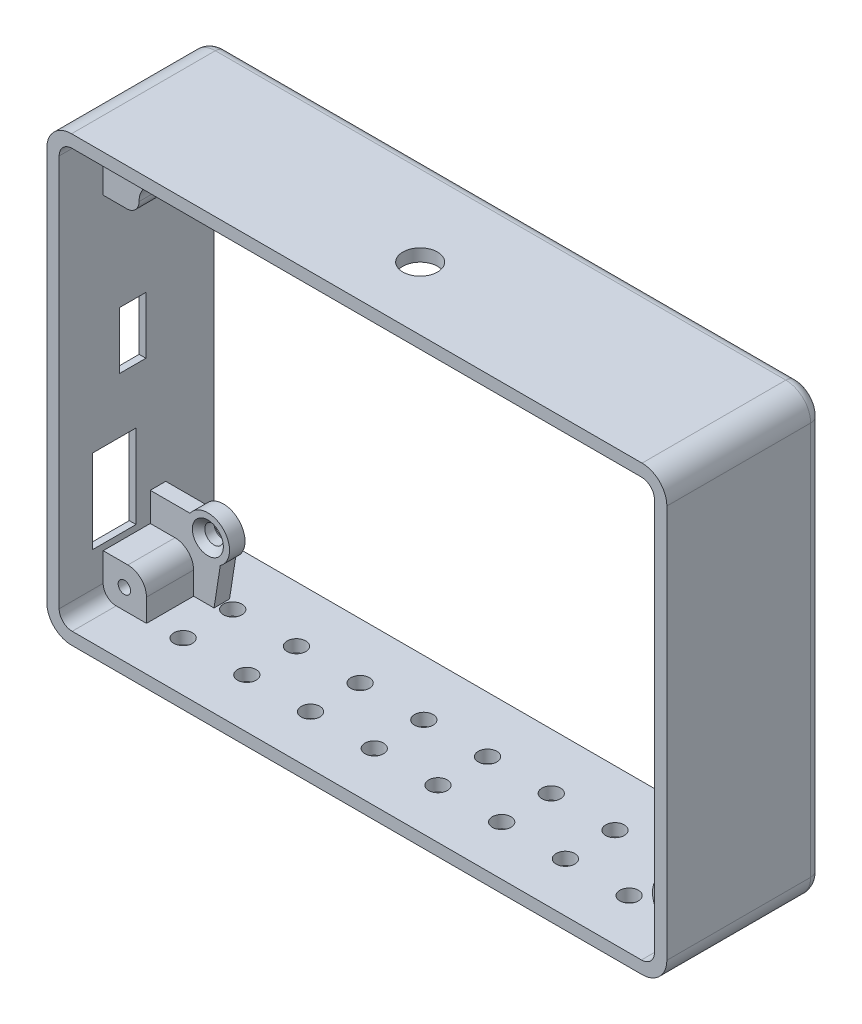
from build123d import *

# Parameters (mm, degrees)
CUT_EXTRUDE_START         = -25
CUT_EXTRUDE_1_OUTLINE_R   = 1
CUT_EXTRUDE_1_OUTLINE_R_2 = 1.5
CUT_EXTRUDE_1_DEPTH       = 17.2
CUT_EXTRUDE_START_2       = -7.8
CUT_EXTRUDE_1_2_DEPTH     = 7.8
CUT_EXTRUDE_2_DEPTH       = 7.1
SKETCH_5_R                = 1.5
SKETCH_5_R_2              = 3.5
CUT_EXTRUDE_3_DEPTH       = 7.6
FILLET_1_R                = 2
FILLET_2_R                = 1.8
SKETCH_12_W               = 9
SKETCH_12_H               = 15.496277761
SKETCH_12_W_2             = 8.286045674
SKETCH_12_H_2             = 13.20751885
CUT_EXTRUDE_7_DEPTH       = 0.90676236
SKETCH_13_W               = 7
SKETCH_13_H               = 13.496277761
SKETCH_13_W_2             = 4.286045674
SKETCH_13_H_2             = 9.20751885
CUT_EXTRUDE_8_DEPTH       = 10
SKETCH_14_W               = 10
SKETCH_14_H               = 5
CUT_EXTRUDE_9_DEPTH       = 7.6
FILLET_3_R                = 0.8
SKETCH_16_R               = 2.8
CUT_EXTRUDE_10_DEPTH      = 2
SKETCH_17_R               = 1.5
CUT_EXTRUDE_11_DEPTH      = 2
SKETCH_18_W               = 4.300074763
SKETCH_18_H               = 6.665650657
CUT_EXTRUDE_12_DEPTH      = 7.6
FILLET_4_R                = 3
CUT_EXTRUDE_13_DEPTH      = 2.6
SKETCH_20_W               = 3
SKETCH_20_H               = 23.2
EXTRUDE_2_DEPTH           = 2
CHAMFER_2_SIZE            = 2
CHAMFER_3_SIZE            = 1


with BuildPart() as part:
    # Вырез-Вытянуть1: read off the stored shape, not the designer's step
    # Вырез-Вытянуть1 outline → Вырез-Вытянуть1 (new body)
    with BuildSketch(Plane(origin=(0, 0, 0), x_dir=(-1, 0, 0), z_dir=(0, 0, -1)).offset(CUT_EXTRUDE_START)):
        with BuildLine():
            Line((46.025, 35.7375), (-46.025, 35.7375))
            ThreePointArc((-46.025, 35.7375), (-48.853427125, 34.565927125), (-50.025, 31.7375))
            Line((-50.025, 31.7375), (-50.025, -31.7375))
            ThreePointArc((-50.025, -31.7375), (-48.853427125, -34.565927125), (-46.025, -35.7375))
            Line((-46.025, -35.7375), (46.025, -35.7375))
            ThreePointArc((46.025, -35.7375), (48.853427125, -34.565927125), (50.025, -31.7375))
            Line((50.025, -31.7375), (50.025, 31.7375))
            ThreePointArc((50.025, 31.7375), (48.853427125, 34.565927125), (46.025, 35.7375))
        make_face()
        with BuildLine():
            ThreePointArc((-42.287410651, -33.7375), (-40.609110189, -30.427578056), (-42.373582962, -27.162779204))
            ThreePointArc((-42.373582962, -27.162779204), (-42.176095909, -21.875777657), (-47.437281323, -22.433733333))
            Line((-47.437281323, -22.433733333), (-48.025, -22.433733333))
            Line((-48.025, -22.433733333), (-48.025, 22.606266667))
            Line((-48.025, 22.606266667), (-47.437281323, 22.606266667))
            ThreePointArc((-47.437281323, 22.606266667), (-42.180470358, 22.044232634), (-42.364269143, 27.32780735))
            ThreePointArc((-42.364269143, 27.32780735), (-40.612710996, 30.461140888), (-42.07941, 33.7375))
            Line((-42.07941, 33.7375), (36.735, 33.7375))
            Line((36.735, 33.7375), (36.735, 27.47854799))
            ThreePointArc((36.735, 27.47854799), (36.260126266, 22.131392933), (41.607281323, 22.606266667))
            Line((41.607281323, 22.606266667), (48.025, 22.606266667))
            Line((48.025, 22.606266667), (48.025, -22.433733333))
            Line((48.025, -22.433733333), (41.607281323, -22.433733333))
            ThreePointArc((41.607281323, -22.433733333), (36.260126265, -21.9588596), (36.735, -27.306014657))
            Line((36.735, -27.306014657), (36.735, -33.7375))
            Line((36.735, -33.7375), (-42.287410651, -33.7375))
        make_face(mode=Mode.SUBTRACT)
        with BuildLine():
            Line((-48.025, -23.906097095), (-48.025, -24.961369572))
            ThreePointArc((-48.025, -24.961369572), (-48.065, -24.433733334), (-48.025, -23.906097095))
        make_face(mode=Mode.SUBTRACT)
        with Locations((-44.608766667, -30.48)):
            Circle(CUT_EXTRUDE_1_OUTLINE_R, mode=Mode.SUBTRACT)
        with Locations((-44.565, -24.433733333)):
            Circle(CUT_EXTRUDE_1_OUTLINE_R_2, mode=Mode.SUBTRACT)
        with Locations((38.735, -24.433733333)):
            Circle(CUT_EXTRUDE_1_OUTLINE_R_2, mode=Mode.SUBTRACT)
        with Locations((44.608733333, -30.48)):
            Circle(CUT_EXTRUDE_1_OUTLINE_R, mode=Mode.SUBTRACT)
        with Locations((44.608733333, 30.48)):
            Circle(CUT_EXTRUDE_1_OUTLINE_R, mode=Mode.SUBTRACT)
        with Locations((38.735, 24.606266667)):
            Circle(CUT_EXTRUDE_1_OUTLINE_R_2, mode=Mode.SUBTRACT)
        with Locations((-44.565, 24.606266667)):
            Circle(CUT_EXTRUDE_1_OUTLINE_R_2, mode=Mode.SUBTRACT)
        with Locations((-44.608766667, 30.638733333)):
            Circle(CUT_EXTRUDE_1_OUTLINE_R, mode=Mode.SUBTRACT)
    extrude(amount=CUT_EXTRUDE_1_DEPTH)

    # Cut-Extrude 1 2 outline → Cut-Extrude 1 2 (add)
    with BuildSketch(Plane(origin=(0, 0, 0), x_dir=(-1, 0, 0), z_dir=(0, 0, -1)).offset(CUT_EXTRUDE_START_2)):
        with BuildLine():
            Line((46.025, 35.7375), (-46.025, 35.7375))
            ThreePointArc((-46.025, 35.7375), (-48.853427125, 34.565927125), (-50.025, 31.7375))
            Line((-50.025, 31.7375), (-50.025, -31.7375))
            ThreePointArc((-50.025, -31.7375), (-48.853427125, -34.565927125), (-46.025, -35.7375))
            Line((-46.025, -35.7375), (46.025, -35.7375))
            ThreePointArc((46.025, -35.7375), (48.853427125, -34.565927125), (50.025, -31.7375))
            Line((50.025, -31.7375), (50.025, 31.7375))
            ThreePointArc((50.025, 31.7375), (48.853427125, 34.565927125), (46.025, 35.7375))
        make_face()
        with BuildLine():
            Line((45.925, -33.7375), (-45.925, -33.7375))
            ThreePointArc((-45.925, -33.7375), (-47.40992424, -33.12242424), (-48.025, -31.6375))
            Line((-48.025, -31.6375), (-48.025, -24.961369572))
            ThreePointArc((-48.025, -24.961369572), (-48.065, -24.433733334), (-48.025, -23.906097095))
            Line((-48.025, -23.906097095), (-48.025, 31.6375))
            ThreePointArc((-48.025, 31.6375), (-47.40992424, 33.12242424), (-45.925, 33.7375))
            Line((-45.925, 33.7375), (45.925, 33.7375))
            ThreePointArc((45.925, 33.7375), (47.40992424, 33.12242424), (48.025, 31.6375))
            Line((48.025, 31.6375), (48.025, -31.6375))
            ThreePointArc((48.025, -31.6375), (47.40992424, -33.12242424), (45.925, -33.7375))
        make_face(mode=Mode.SUBTRACT)
    extrude(amount=CUT_EXTRUDE_1_2_DEPTH)

    # Эскиз4 → Вырез-Вытянуть2 (cut)
    with BuildSketch(Plane.XY.offset(25)):
        with BuildLine():
            Line((-48.025, 31.6375), (-48.025, -31.6375))
            ThreePointArc((-48.025, -31.6375), (-47.40992424, -33.12242424), (-45.925, -33.7375))
            Line((-45.925, -33.7375), (45.925, -33.7375))
            ThreePointArc((45.925, -33.7375), (47.40992424, -33.12242424), (48.025, -31.6375))
            Line((48.025, -31.6375), (48.025, 31.6375))
            ThreePointArc((48.025, 31.6375), (47.40992424, 33.12242424), (45.925, 33.7375))
            Line((45.925, 33.7375), (-45.925, 33.7375))
            ThreePointArc((-45.925, 33.7375), (-47.40992424, 33.12242424), (-48.025, 31.6375))
        make_face()
    extrude(amount=-CUT_EXTRUDE_2_DEPTH, mode=Mode.SUBTRACT)

    # Эскиз5 → Вырез-Вытянуть3 (cut)
    # profile 1 of 4: a face of its own
    with BuildSketch(Plane.XY.offset(17.9)):
        with BuildLine():
            Line((47.437281323, 22.606266667), (48.025, 22.606266667))
            Line((48.025, 22.606266667), (48.025, 25.133902905))
            ThreePointArc((48.025, 25.133902905), (45.829809817, 27.869739683), (42.364269143, 27.32780735))
            ThreePointArc((42.364269143, 27.32780735), (42.180470358, 22.044232634), (47.437281323, 22.606266667))
        make_face()
    # profile 2 of 4: a face of its own
    with BuildSketch(Plane.XY.offset(17.9)):
        with BuildLine():
            ThreePointArc((-41.607281323, 22.606266667), (-37.686902827, 21.266881646), (-35.235, 24.606266667))
            ThreePointArc((-35.235, 24.606266667), (-35.632581589, 26.226451841), (-36.735, 27.47854799))
            ThreePointArc((-36.735, 27.47854799), (-41.209873734, 27.081140401), (-41.607281323, 22.606266667))
        make_face()
        with Locations(Location((-38.735, 24.606266667, 0), (0, 0, 180))):
            Circle(SKETCH_5_R, mode=Mode.SUBTRACT)
    # profile 3 of 4: a face of its own
    with BuildSketch(Plane.XY.offset(17.9)):
        with BuildLine():
            ThreePointArc((47.437281323, -22.433733333), (42.176095909, -21.875777657), (42.373582962, -27.162779204))
            ThreePointArc((42.373582962, -27.162779204), (45.835384499, -27.695040314), (48.025, -24.961369572))
            Line((48.025, -24.961369572), (48.025, -22.433733333))
            Line((48.025, -22.433733333), (47.437281323, -22.433733333))
        make_face()
    # profile 4 of 4: a face of its own
    with BuildSketch(Plane.XY.offset(17.9)):
        with Locations((-38.735, -24.433733333)):
            Circle(SKETCH_5_R_2)
    extrude(amount=-CUT_EXTRUDE_3_DEPTH, mode=Mode.SUBTRACT)

    # Скругление1
    fillet_1_edges = [part.edges().sort_by_distance(p)[0] for p in [
        (42.364269143, 27.32780735, 14.1),
        (-36.735, 27.47854799, 14.1),
        (-41.607281323, 22.606266667, 14.1),
        (-41.607281323, -22.433733333, 14.1),
        (-36.735, -27.306014657, 14.1),
        (42.373582962, -27.162779204, 14.1),
    ]]
    fillet(fillet_1_edges, radius=FILLET_1_R)

    # Скругление2
    fillet_2_edges = [part.edges().sort_by_distance(p)[0] for p in [
        (48.853427125, 34.565927125, 0),
        (50.025, 0, 0),
        (48.853427125, -34.565927125, 0),
        (0, -35.7375, 0),
        (-48.853427125, -34.565927125, 0),
        (-50.025, 0, 0),
        (-48.853427125, 34.565927125, 0),
        (0, 35.7375, 0),
    ]]
    fillet(fillet_2_edges, radius=FILLET_2_R)

    # Эскиз12 → Вырез-Вытянуть7 (cut)
    with BuildSketch(Plane.ZY.offset(50.025)):
        with Locations((16.100001679, -19.323710462)):
            Rectangle(SKETCH_12_W, SKETCH_12_H)
        with Locations((13.143024516, 0.969901898)):
            Rectangle(SKETCH_12_W_2, SKETCH_12_H_2)
    extrude(amount=-CUT_EXTRUDE_7_DEPTH, mode=Mode.SUBTRACT)

    # Эскиз13 → Вырез-Вытянуть8 (cut)
    with BuildSketch(Plane.ZY.offset(49.11823764)):
        with Locations((16.100001679, -19.323710462)):
            Rectangle(SKETCH_13_W, SKETCH_13_H)
        with Locations((13.143024516, 0.969901898)):
            Rectangle(SKETCH_13_W_2, SKETCH_13_H_2)
    extrude(amount=-CUT_EXTRUDE_8_DEPTH, mode=Mode.SUBTRACT)

    # Эскиз14 → Вырез-Вытянуть9 (cut)
    with BuildSketch(Plane.XY.offset(17.9)):
        with Locations((-43.025, -24.571849343)):
            Rectangle(SKETCH_14_W, SKETCH_14_H)
    extrude(amount=-CUT_EXTRUDE_9_DEPTH, mode=Mode.SUBTRACT)

    # Скругление3
    fillet_3_edges = [part.edges().sort_by_distance(p)[0] for p in [
        (-50.025, -19.323710463, 11.600001679),
        (-50.025, -27.071849343, 16.100001679),
        (-50.025, -19.323710463, 20.600001679),
        (-50.025, -11.575571582, 16.100001679),
        (-50.025, 0.969901898, 9.000001679),
        (-50.025, -5.633857527, 13.143024516),
        (-50.025, 0.969901898, 17.286047353),
        (-50.025, 7.573661323, 13.143024516),
    ]]
    fillet(fillet_3_edges, radius=FILLET_3_R)

    # Эскиз16 → Вырез-Вытянуть10 (cut)
    with BuildSketch(Plane(origin=(0, 35.7375, 0), x_dir=(1, 0, 0), z_dir=(0, 1, 0))):
        with Locations(Location((0.024996753, -14.799996232, 0), (0, 0, 180))):
            Circle(SKETCH_16_R)
    extrude(amount=-CUT_EXTRUDE_10_DEPTH, mode=Mode.SUBTRACT)

    # Эскиз17 → Вырез-Вытянуть11 (cut)
    with BuildSketch(Plane.XZ.offset(35.7375)):
        with Locations(Location((-36.025, 17, 0), (0, 0, 270))):
            Circle(SKETCH_17_R)
        with Locations(Location((-25.745, 17, 0), (0, 0, 270))):
            Circle(SKETCH_17_R)
        with Locations(Location((-15.465, 17, 0), (0, 0, 270))):
            Circle(SKETCH_17_R)
        with Locations(Location((-5.185, 17, 0), (0, 0, 270))):
            Circle(SKETCH_17_R)
        with Locations(Location((5.095, 17, 0), (0, 0, 270))):
            Circle(SKETCH_17_R)
        with Locations(Location((15.375, 17, 0), (0, 0, 270))):
            Circle(SKETCH_17_R)
        with Locations(Location((25.655, 17, 0), (0, 0, 270))):
            Circle(SKETCH_17_R)
        with Locations(Location((35.935, 17, 0), (0, 0, 270))):
            Circle(SKETCH_17_R)
        with Locations(Location((-25.745, 9, 0), (0, 0, 270))):
            Circle(SKETCH_17_R)
        with Locations(Location((-15.465, 9, 0), (0, 0, 270))):
            Circle(SKETCH_17_R)
        with Locations(Location((-5.185, 9, 0), (0, 0, 270))):
            Circle(SKETCH_17_R)
        with Locations(Location((5.095, 9, 0), (0, 0, 270))):
            Circle(SKETCH_17_R)
        with Locations(Location((15.375, 9, 0), (0, 0, 270))):
            Circle(SKETCH_17_R)
        with Locations(Location((25.655, 9, 0), (0, 0, 270))):
            Circle(SKETCH_17_R)
        with Locations(Location((35.935, 9, 0), (0, 0, 270))):
            Circle(SKETCH_17_R)
        with Locations(Location((-36.025, 9, 0), (0, 0, 270))):
            Circle(SKETCH_17_R)
    extrude(amount=-CUT_EXTRUDE_11_DEPTH, mode=Mode.SUBTRACT)

    # Эскиз18 → Вырез-Вытянуть12 (cut)
    with BuildSketch(Plane.XY.offset(17.9)):
        with Locations((-38.885037381, -30.404674672)):
            Rectangle(SKETCH_18_W, SKETCH_18_H)
    extrude(amount=-CUT_EXTRUDE_12_DEPTH, mode=Mode.SUBTRACT)

    # Скругление4
    fillet_4_edges = [part.edges().sort_by_distance(p)[0] for p in [
        (-41.035074763, -27.071849343, 14.1),
    ]]
    fillet(fillet_4_edges, radius=FILLET_4_R)

    # Эскиз19 → Вырез-Вытянуть13 (cut)
    with BuildSketch(Plane.XY.offset(10.3)):
        Polygon((-36.735, -27.306014657), (-37.735, -33.7375), (-36.735, -33.7375), align=None)
    extrude(amount=-CUT_EXTRUDE_13_DEPTH, mode=Mode.SUBTRACT)

    # Эскиз20 → Бобышка-Вытянуть2 (add)
    with BuildSketch(Plane.XZ.offset(35.7375)):
        with Locations((-41.525, 13.4)):
            Rectangle(SKETCH_20_W, SKETCH_20_H)
        with Locations((41.525, 13.4)):
            Rectangle(SKETCH_20_W, SKETCH_20_H)
    extrude(amount=EXTRUDE_2_DEPTH)

    # Фаска2
    chamfer_2_edges = [part.edges().sort_by_distance(p)[0] for p in [
        (41.525, -37.7375, 25),
        (41.525, -37.7375, 1.8),
        (-41.525, -37.7375, 1.8),
        (-41.525, -37.7375, 25),
    ]]
    chamfer(chamfer_2_edges, length=CHAMFER_2_SIZE - 0.0001)  # a hair under: the kernel refuses the full size

    # Фаска3
    chamfer_3_edges = [part.edges().sort_by_distance(p)[0] for p in [
        (-37.235, 24.606266667, 10.3),
        (46.065, -24.433733333, 10.3),
        (-37.235, -24.433733333, 10.3),
        (46.065, 24.606266667, 10.3),
    ]]
    chamfer(chamfer_3_edges, length=CHAMFER_3_SIZE)


solid = part.part
